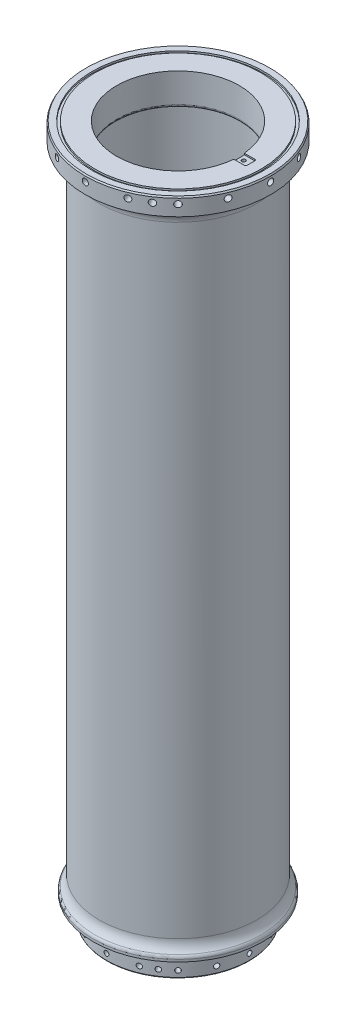
from build123d import *

# Parameters (mm, degrees)
PATTERN_CIRCULAR_1_COUNT = 16
FILLET_1_R               = 10
PATTERN_CIRCULAR_2_COUNT = 16
PATTERN_CIRCULAR_3_COUNT = 2
PATTERN_CIRCULAR_3_ANGLE = 123.75000000000027
PATTERN_CIRCULAR_4_COUNT = 2
PATTERN_CIRCULAR_4_ANGLE = 123.7500000000003
FILLET_2_R               = 2
FILLET_3_R               = 3
PATTERN_CIRCULAR_5_COUNT = 2
PATTERN_CIRCULAR_5_ANGLE = 123.75000000000027
PATTERN_CIRCULAR_6_COUNT = 2
PATTERN_CIRCULAR_6_ANGLE = 123.7500000000003
CUT_EXTRUDE_1_DEPTH      = 1
HOLE_WIZARD_M3_1_D       = 2.5
HOLE_WIZARD_M3_1_DEPTH   = 7.5
HOLE_WIZARD_M3_1_TIP     = 0.7510757737844503
FILLET_4_R               = 1
CUT_EXTRUDE_2_DEPTH      = 5
FILLET_5_R               = 1
HOLE_WIZARD_M3_2_D       = 2.5
HOLE_WIZARD_M3_2_DEPTH   = 7.5
HOLE_WIZARD_M3_2_TIP     = 0.7510757737844503
CHAMFER_1_SIZE           = 1
CHAMFER_1_SIZE2          = 0.5773502691896273
CHAMFER_2_SIZE           = 0.3
CHAMFER_2_SIZE2          = 0.519615242270666
SKETCH_16_R              = 47.95
SKETCH_16_R_2            = 45.85
CUT_EXTRUDE_3_DEPTH      = 1.2
SKETCH_17_R              = 58.81
SKETCH_17_R_2            = 57.010000000000005
CUT_EXTRUDE_4_DEPTH      = 1.2


with BuildPart() as part:
    # 草图1 → 旋转1 (revolve)
    with BuildSketch(Plane.XY, mode=Mode.PRIVATE) as revolve_1_sk:
        Polygon((-42, -2.4e-16), (-63.5, 0), (-63.5, -12.000000000000004), (-53.99999999999994, -12.00000000000001), (-53.99999999999994, -455), (-57.99999999999995, -455), (-57.99999999999995, -458), (-48.99999999999994, -458), (-48.99999999999994, -474.00000000000006), (-39.49999999999994, -474.00000000000006), (-39.49999999999994, -451), (-47.99999999999989, -451), (-47.99999999999994, -22.000000000000007), (-42, -22.000000000000007), align=None)
    revolve(revolve_1_sk.sketch.rotate(Axis((0, 0, 0), (0, -1, 0)), 270), axis=Axis((0, 0, 0), (0, -1, 0)))

    # 草图7 → M5 螺纹孔4 (revolve, cut)
    with BuildSketch(Plane(origin=(-63.5, -4.5, 0), x_dir=(0, 0, 1), z_dir=(0, 1, 0))):
        Polygon((0, 0), (-3.74e-15, 15.261807299957878), (2.099999999999997, 14.000000000000002), (2.099999999999989, -1.3e-15), align=None)
    hole_wizard_m5_4 = revolve(axis=Axis((-69.85, -4.5, 0), (1, 0, 0)), mode=Mode.SUBTRACT)

    # 阵列(圆周)1: M5 螺纹孔4 ×16 about axis
    pattern_circular_1_axis = Axis((0, 0, 0), (0, 1, 0))
    for i in range(1, PATTERN_CIRCULAR_1_COUNT):
        add(hole_wizard_m5_4.rotate(pattern_circular_1_axis, i * 360 / PATTERN_CIRCULAR_1_COUNT), mode=Mode.SUBTRACT)

    # 圆角1
    # the kernel refuses this fillet: 10 mm, written as the material it adds along each edge
    with BuildSketch(Plane(origin=(0, -12.00000000000001, 0), x_dir=(2.2e-16, 0, 1), z_dir=(1, 0, -2.2e-16))) as fillet_1_piece_1:
        with BuildLine():
            CenterArc((63.99999999999994, 9.987492177719083), FILLET_1_R, 180, 87.13401601740145)
            Line((53.99999999999994, 9.987492177719083), (53.79999999999994, 9.987492177719083))
            Line((53.79999999999994, 9.987492177719083), (53.79999999999994, 0))
            Line((53.79999999999994, 0), (53.99999999999994, -0.1999999999999993))
            ThreePointArc((53.99999999999994, -0.1999999999999993), (58.74999999999997, -0.2000000000000064), (63.49, -0.1997498435543914))
            Line((63.49, -0.1997498435543914), (63.5, -8.88e-15))
        make_face()
    revolve(axis=Axis((0, -12.00000000000001, 0), (0, -1, 0)))
    with BuildSketch(Plane(origin=(0, -455, 0), x_dir=(2.2e-16, 0, 1), z_dir=(1, 0, -2.2e-16))) as fillet_1_piece_2:
        with BuildLine():
            CenterArc((63.99999999999994, -8), FILLET_1_R, 126.86989764584399, 53.13010235415601)
            Line((57.99999999999995, 0), (57.87999999999995, 0.160000000000025))
            ThreePointArc((57.87999999999995, 0.160000000000025), (55.99999999999994, 0.19999999999998863), (53.99999999999994, 0.19999999999998863))
            Line((53.99999999999994, 0.19999999999998863), (53.79999999999994, 0))
            Line((53.79999999999994, 0), (53.79999999999994, -8))
            Line((53.79999999999994, -8), (53.99999999999994, -8))
        make_face()
    revolve(axis=Axis((0, -455, 0), (0, -1, 0)))

    # 草图9 → M4 螺纹孔1 (revolve, cut)
    with BuildSketch(Plane(origin=(-48.99999999999994, -469.30000000000007, 0), x_dir=(0, 0, 1), z_dir=(0, 1, 0))):
        Polygon((0, 0), (-2.72e-15, 11.091420021395475), (1.6499999999999972, 10.1), (1.6499999999999984, -6e-17), align=None)
    hole_wizard_m4_1 = revolve(axis=Axis((-55.34999999999994, -469.30000000000007, 0), (1, 0, 0)), mode=Mode.SUBTRACT)

    # 阵列(圆周)2: M4 螺纹孔1 ×16 about axis
    pattern_circular_2_axis = Axis((0, 0, 0), (0, 1, 0))
    for i in range(1, PATTERN_CIRCULAR_2_COUNT):
        add(hole_wizard_m4_1.rotate(pattern_circular_2_axis, i * 360 / PATTERN_CIRCULAR_2_COUNT), mode=Mode.SUBTRACT)

    # 阵列(圆周)3: M4 螺纹孔1 ×2 about axis
    pattern_circular_3_axis = Axis((0, 0, 0), (0, 1, 0))
    for i in range(1, PATTERN_CIRCULAR_3_COUNT):
        add(hole_wizard_m4_1.rotate(pattern_circular_3_axis, i * PATTERN_CIRCULAR_3_ANGLE / (PATTERN_CIRCULAR_3_COUNT - 1)), mode=Mode.SUBTRACT)

    # 阵列(圆周)4: M4 螺纹孔1 ×2 about axis
    pattern_circular_4_axis = Axis((0, 0, 0), (0, -1, 0))
    for i in range(1, PATTERN_CIRCULAR_4_COUNT):
        add(hole_wizard_m4_1.rotate(pattern_circular_4_axis, i * PATTERN_CIRCULAR_4_ANGLE / (PATTERN_CIRCULAR_4_COUNT - 1)), mode=Mode.SUBTRACT)

    # 圆角2
    fillet_2_edges = [part.edges().sort_by_distance(p)[0] for p in [
        (-1.361e-14, -451, -39.49999999999994),
        (-1.654e-14, -451, -47.99999999999989),
        (-1.654e-14, -22.000000000000007, -47.99999999999994),
        (-1.447e-14, -22.000000000000007, -42),
    ]]
    fillet(fillet_2_edges, radius=FILLET_2_R)

    # 圆角3
    fillet_3_edges = [part.edges().sort_by_distance(p)[0] for p in [
        (-1.998e-14, -455, -57.99999999999995),
    ]]
    fillet(fillet_3_edges, radius=FILLET_3_R)

    # 阵列(圆周)5: M5 螺纹孔4 ×2 about axis
    pattern_circular_5_axis = Axis((0, 0, 0), (0, 1, 0))
    for i in range(1, PATTERN_CIRCULAR_5_COUNT):
        add(hole_wizard_m5_4.rotate(pattern_circular_5_axis, i * PATTERN_CIRCULAR_5_ANGLE / (PATTERN_CIRCULAR_5_COUNT - 1)), mode=Mode.SUBTRACT)

    # 阵列(圆周)6: M5 螺纹孔4 ×2 about axis
    pattern_circular_6_axis = Axis((0, 0, 0), (0, -1, 0))
    for i in range(1, PATTERN_CIRCULAR_6_COUNT):
        add(hole_wizard_m5_4.rotate(pattern_circular_6_axis, i * PATTERN_CIRCULAR_6_ANGLE / (PATTERN_CIRCULAR_6_COUNT - 1)), mode=Mode.SUBTRACT)

    # 草图12 → 切除-拉伸1 (cut)
    with BuildSketch(Plane(origin=(0, 0, 0), x_dir=(1, 0, 0), z_dir=(0, 1, 0))):
        Polygon((49.99999999999997, -3.5999999999999948), (25.999999999999982, -3.5999999999999948), (25.999999999999982, 3.5999999999999983), (49.99999999999997, 3.6000000000000036), align=None)
    extrude(amount=-CUT_EXTRUDE_1_DEPTH, mode=Mode.SUBTRACT)

    # M3 螺纹孔1
    with Locations(Plane(origin=(0, -1, 0), x_dir=(1, 0, 0), z_dir=(0, 1, 0))):
        with Locations((45, 0)):
            Hole(HOLE_WIZARD_M3_1_D / 2, depth=HOLE_WIZARD_M3_1_DEPTH)
            with Locations((0, 0, -(HOLE_WIZARD_M3_1_DEPTH + HOLE_WIZARD_M3_1_TIP / 2))):  # 118° drill point
                Cone(0, HOLE_WIZARD_M3_1_D / 2, HOLE_WIZARD_M3_1_TIP, mode=Mode.SUBTRACT)

    # 圆角4
    fillet_4_edges = [part.edges().sort_by_distance(p)[0] for p in [
        (49.99999999999997, -0.5, -3.6000000000000036),
        (49.99999999999997, -0.5, 3.5999999999999948),
    ]]
    fillet(fillet_4_edges, radius=FILLET_4_R)

    # 草图13 → 切除-拉伸2 (cut)
    with BuildSketch(Plane.XZ.offset(474.00000000000006)):
        Polygon((44.413797739290644, -12.504981822193226), (32.64437437445185, -10.163897957999763), (34.04902469296793, -3.102243939096497), (45.81844805780671, -5.443327803289961), align=None)
    extrude(amount=-CUT_EXTRUDE_2_DEPTH, mode=Mode.SUBTRACT)

    # 圆角5
    fillet_5_edges = [part.edges().sort_by_distance(p)[0] for p in [
        (45.81844805780671, -471.50000000000006, -5.443327803289961),
        (44.413797739290644, -471.50000000000006, -12.504981822193226),
    ]]
    fillet(fillet_5_edges, radius=FILLET_5_R)

    # M3 螺纹孔2
    with Locations(Plane(origin=(0, -469, 0), x_dir=(-1, 0, 0), z_dir=(0, -1, 0))):
        with Locations((-40.700719252, 8.105643245)):
            Hole(HOLE_WIZARD_M3_2_D / 2, depth=HOLE_WIZARD_M3_2_DEPTH)
            with Locations((0, 0, -(HOLE_WIZARD_M3_2_DEPTH + HOLE_WIZARD_M3_2_TIP / 2))):  # 118° drill point
                Cone(0, HOLE_WIZARD_M3_2_D / 2, HOLE_WIZARD_M3_2_TIP, mode=Mode.SUBTRACT)

    # 倒角1
    chamfer_1_edges = [part.edges().sort_by_distance(p)[0] for p in [
        (-2.188e-14, 0, -63.5),
    ]]
    chamfer_1_side = [part.faces().sort_by_distance(p)[0] for p in [
        (-2.188e-14, -6.000000000000002, -63.5),
    ]]
    chamfer(chamfer_1_edges, length=CHAMFER_1_SIZE, length2=CHAMFER_1_SIZE2, reference=chamfer_1_side[0])

    # 倒角2
    chamfer_2_edges = [part.edges().sort_by_distance(p)[0] for p in [
        (-1.688e-14, -474.00000000000006, -48.99999999999994),
    ]]
    chamfer_2_side = [part.faces().sort_by_distance(p)[0] for p in [
        (40.38485456555202, -474.00000000000006, -13.116656448600407),
    ]]
    chamfer(chamfer_2_edges, length=CHAMFER_2_SIZE, length2=CHAMFER_2_SIZE2, reference=chamfer_2_side[0])

    # 草图16 → 切除-拉伸3 (cut)
    with BuildSketch(Plane.XZ.offset(474.00000000000006)):
        with Locations(Location((0, 0, 0), (0, 0, 270))):
            Circle(SKETCH_16_R)
        Circle(SKETCH_16_R_2, mode=Mode.SUBTRACT)
    extrude(amount=-CUT_EXTRUDE_3_DEPTH, mode=Mode.SUBTRACT)

    # 草图17 → 切除-拉伸4 (cut)
    with BuildSketch(Plane(origin=(0, 0, 0), x_dir=(1, 0, 0), z_dir=(0, 1, 0))):
        with Locations(Location((0, 0, 0), (0, 0, 270))):
            Circle(SKETCH_17_R)
        with Locations(Location((0, 0, 0), (0, 0, 270))):
            Circle(SKETCH_17_R_2, mode=Mode.SUBTRACT)
    extrude(amount=-CUT_EXTRUDE_4_DEPTH, mode=Mode.SUBTRACT)


solid = part.part
